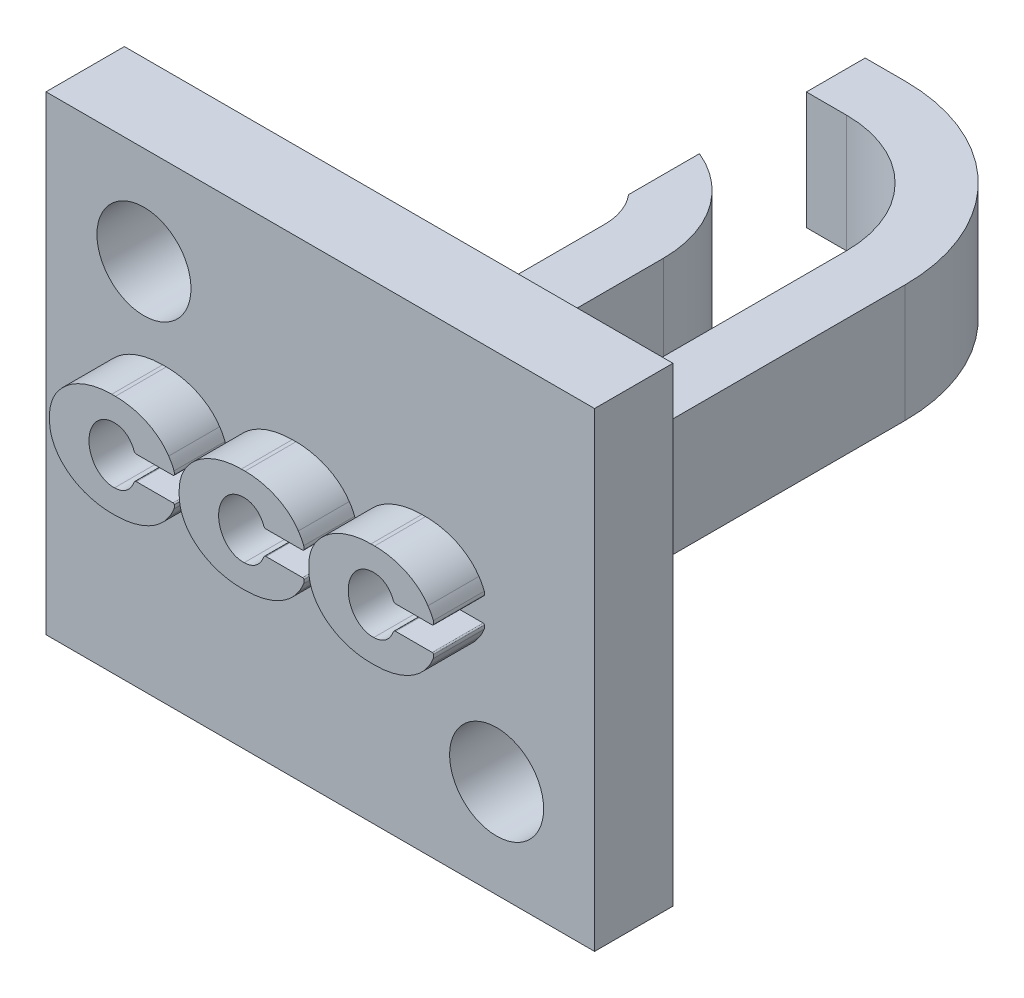
from build123d import *

# Parameters (mm, degrees)
SKETCH1_W           = 15
SKETCH1_H           = 12
BOSS_EXTRUDE1_DEPTH = 2
BOSS_EXTRUDE2_DEPTH = 2
SKETCH3_W           = 1.5
SKETCH3_H           = 3.5
BOSS_EXTRUDE3_DEPTH = 1.5
FILLET3_R           = 1.5
FILLET4_R           = 3
FILLET5_R           = 3
FILLET6_R           = 4.5
SKETCH4_W           = 2
SKETCH4_H           = 12
CUT_EXTRUDE1_DEPTH  = 1
SKETCH5_R           = 1.2
CUT_EXTRUDE2_DEPTH  = 17.731407672
CUT_EXTRUDE3_START  = -0.7
CUT_EXTRUDE3_DEPTH  = 0.7
SKETCH7_W           = 1.148621372
SKETCH7_H           = 6.2
CUT_EXTRUDE4_DEPTH  = 18.325992122
SKETCH8_W           = 0.2
SKETCH8_H           = 3.5
CUT_EXTRUDE5_DEPTH  = 18.325992122


with BuildPart() as part:
    # Sketch1 → Boss-Extrude1 (new body)
    with BuildSketch(Plane.XY):
        Rectangle(SKETCH1_W, SKETCH1_H)
    extrude(amount=BOSS_EXTRUDE1_DEPTH)

    # Sketch2 → Boss-Extrude2 (add)
    with BuildSketch(Plane.XY.offset(2)):
        with BuildLine():
            Line((-0.583484164, 0.443787032), (0.352350759, 0.443787032))
            ThreePointArc((0.352350759, 0.443787032), (0.370660979, 0.451874829), (0.381594807, 0.468641703))
            ThreePointArc((0.381594807, 0.468641703), (0.38478126, 0.512633483), (0.377406248, 0.556119567))
            ThreePointArc((0.377406248, 0.556119567), (0.316958398, 0.689104808), (0.240244136, 0.81341868))
            add(Edge.make_bspline(
                [(0.240244136, 0.81341868), (-0.178053426, 1.454553053), (-1.120854898, 1.454553053)],
                knots=[3.484341046, 3.484341046, 3.484341046, 4.522924348, 4.522924348, 4.522924348], degree=2, weights=[1, 0.868170926, 1]))
            Line((-1.120854898, 1.454553053), (-1.214475951, 1.454553068))
            add(Edge.make_bspline(
                [(-1.214475951, 1.454553068), (-2.800132813, 1.454553068), (-2.800132813, 0.203397992)],
                knots=[1.670440536, 1.670440536, 1.670440536, 3.203377674, 3.203377674, 3.203377674], degree=2, weights=[1, 0.720364542, 1]))
            Line((-2.800132813, 0.203397992), (-2.800132806, 0.073267738))
            add(Edge.make_bspline(
                [(-2.800132806, 0.073267738), (-2.800132806, -1.177887338), (-1.214475944, -1.177887338)],
                knots=[3.079807634, 3.079807634, 3.079807634, 4.612744771, 4.612744771, 4.612744771], degree=2, weights=[1, 0.720364542, 1]))
            Line((-1.214475944, -1.177887338), (-1.120854891, -1.177887375))
            add(Edge.make_bspline(
                [(-1.120854891, -1.177887375), (-0.178053419, -1.177887375), (0.240244143, -0.536753002)],
                knots=[1.760260959, 1.760260959, 1.760260959, 2.798844261, 2.798844261, 2.798844261], degree=2, weights=[1, 0.868170926, 1]))
            ThreePointArc((0.240244143, -0.536753002), (0.313994237, -0.417650167), (0.372658208, -0.290437354))
            ThreePointArc((0.372658208, -0.290437354), (0.384251196, -0.24211404), (0.382489087, -0.192450825))
            ThreePointArc((0.382489087, -0.192450825), (0.370484527, -0.171527836), (0.347824512, -0.163257123))
            Line((0.347824512, -0.163257123), (-0.58348421, -0.163257123))
            ThreePointArc((-0.58348421, -0.163257123), (-0.62125204, -0.175257922), (-0.645165579, -0.206858093))
            add(Edge.make_bspline(
                [(-1.141657158, -0.577741646), (-0.776549247, -0.578100851), (-0.645165579, -0.206858093)],
                knots=[5.955155363, 5.955155363, 5.955155363, 7.020735545, 7.020735545, 7.020735545], degree=2, weights=[1, 0.86139323, 1]))
            add(Edge.make_bspline(
                [(-1.201450314, 0.854894524), (-1.823540048, 0.823436889), (-1.793554178, 0.104979402), (-1.763568309, -0.613478086), (-1.141657158, -0.577741646)],
                knots=[0.039432941, 0.039432941, 0.039432941, 1.613207044, 1.613207044, 3.186981147, 3.186981147, 3.186981147], degree=2, weights=[1, 0.706053195, 1, 0.706053195, 1]))
            add(Edge.make_bspline(
                [(-0.645165584, 0.487388037), (-0.79140441, 0.900606071), (-1.201450314, 0.854894524)],
                knots=[2.404042441, 2.404042441, 2.404042441, 3.565685694, 3.565685694, 3.565685694], degree=2, weights=[1, 0.836012096, 1]))
            ThreePointArc((-0.645165584, 0.487388037), (-0.621252025, 0.455787841), (-0.583484164, 0.443787032))
        make_face()
        with BuildLine():
            Line((-3.89178871, 0.443787032), (-2.955953786, 0.443787032))
            ThreePointArc((-2.955953786, 0.443787032), (-2.937643536, 0.451874816), (-2.926709688, 0.468641703))
            ThreePointArc((-2.926709688, 0.468641703), (-2.923523234, 0.512633483), (-2.930898247, 0.556119567))
            ThreePointArc((-2.930898247, 0.556119567), (-2.991346096, 0.689104808), (-3.068060358, 0.81341868))
            add(Edge.make_bspline(
                [(-3.068060358, 0.81341868), (-3.48635792, 1.454553053), (-4.429159392, 1.454553053)],
                knots=[3.484341046, 3.484341046, 3.484341046, 4.522924348, 4.522924348, 4.522924348], degree=2, weights=[1, 0.868170926, 1]))
            Line((-4.429159392, 1.454553053), (-4.522780446, 1.454553068))
            add(Edge.make_bspline(
                [(-4.522780446, 1.454553068), (-6.108437307, 1.454553068), (-6.108437307, 0.203397992)],
                knots=[4.81203319, 4.81203319, 4.81203319, 6.344970327, 6.344970327, 6.344970327], degree=2, weights=[1, 0.720364542, 1]))
            Line((-6.108437307, 0.203397992), (-6.108437352, 0.073267738))
            add(Edge.make_bspline(
                [(-6.108437352, 0.073267738), (-6.108437352, -1.177887338), (-4.52278049, -1.177887338)],
                knots=[6.221400287, 6.221400287, 6.221400287, 7.754337425, 7.754337425, 7.754337425], degree=2, weights=[1, 0.720364542, 1]))
            Line((-4.52278049, -1.177887338), (-4.429159437, -1.177887375))
            add(Edge.make_bspline(
                [(-4.429159437, -1.177887375), (-3.486357965, -1.177887375), (-3.068060402, -0.536753002)],
                knots=[1.760260959, 1.760260959, 1.760260959, 2.798844261, 2.798844261, 2.798844261], degree=2, weights=[1, 0.868170926, 1]))
            ThreePointArc((-3.068060402, -0.536753002), (-2.994310308, -0.417650167), (-2.935646337, -0.290437354))
            ThreePointArc((-2.935646337, -0.290437354), (-2.92405335, -0.24211404), (-2.925815458, -0.192450825))
            ThreePointArc((-2.925815458, -0.192450825), (-2.937820019, -0.171527836), (-2.960480033, -0.163257123))
            Line((-2.960480033, -0.163257123), (-3.891788755, -0.163257123))
            ThreePointArc((-3.891788755, -0.163257123), (-3.929556585, -0.175257922), (-3.953470124, -0.206858093))
            add(Edge.make_bspline(
                [(-4.449961703, -0.577741646), (-4.084853792, -0.578100851), (-3.953470124, -0.206858093)],
                knots=[5.955155363, 5.955155363, 5.955155363, 7.020735545, 7.020735545, 7.020735545], degree=2, weights=[1, 0.86139323, 1]))
            add(Edge.make_bspline(
                [(-4.509754859, 0.854894524), (-5.131844593, 0.82343689), (-5.101858724, 0.104979402), (-5.071872854, -0.613478086), (-4.449961703, -0.577741646)],
                knots=[0.039432941, 0.039432941, 0.039432941, 1.613207044, 1.613207044, 3.186981147, 3.186981147, 3.186981147], degree=2, weights=[1, 0.706053195, 1, 0.706053195, 1]))
            add(Edge.make_bspline(
                [(-3.95347013, 0.487388037), (-4.099708956, 0.900606071), (-4.509754859, 0.854894524)],
                knots=[2.40404244, 2.40404244, 2.40404244, 3.565685694, 3.565685694, 3.565685694], degree=2, weights=[1, 0.836012096, 1]))
            ThreePointArc((-3.95347013, 0.487388037), (-3.92955657, 0.455787841), (-3.89178871, 0.443787032))
        make_face()
        with BuildLine():
            Line((2.724820382, 0.443787032), (3.660655305, 0.443787032))
            ThreePointArc((3.660655305, 0.443787032), (3.678965525, 0.451874829), (3.689899353, 0.468641703))
            ThreePointArc((3.689899353, 0.468641703), (3.693085806, 0.512633483), (3.685710794, 0.556119567))
            ThreePointArc((3.685710794, 0.556119567), (3.625262944, 0.689104808), (3.548548682, 0.81341868))
            add(Edge.make_bspline(
                [(3.548548682, 0.81341868), (3.13025112, 1.454553053), (2.187449648, 1.454553053)],
                knots=[0.342748392, 0.342748392, 0.342748392, 1.381331695, 1.381331695, 1.381331695], degree=2, weights=[1, 0.868170926, 1]))
            Line((2.187449648, 1.454553053), (2.093828595, 1.454553068))
            add(Edge.make_bspline(
                [(2.093828595, 1.454553068), (0.508171733, 1.454553068), (0.508171733, 0.203397992)],
                knots=[4.81203319, 4.81203319, 4.81203319, 6.344970327, 6.344970327, 6.344970327], degree=2, weights=[1, 0.720364542, 1]))
            Line((0.508171733, 0.203397992), (0.50817174, 0.073267738))
            add(Edge.make_bspline(
                [(0.50817174, 0.073267738), (0.50817174, -1.177887338), (2.093828602, -1.177887338)],
                knots=[3.079807634, 3.079807634, 3.079807634, 4.612744771, 4.612744771, 4.612744771], degree=2, weights=[1, 0.720364542, 1]))
            Line((2.093828602, -1.177887338), (2.187449655, -1.177887375))
            add(Edge.make_bspline(
                [(2.187449655, -1.177887375), (3.130251127, -1.177887375), (3.548548689, -0.536753002)],
                knots=[1.760260959, 1.760260959, 1.760260959, 2.798844261, 2.798844261, 2.798844261], degree=2, weights=[1, 0.868170926, 1]))
            ThreePointArc((3.548548689, -0.536753002), (3.622298783, -0.417650167), (3.680962754, -0.290437354))
            ThreePointArc((3.680962754, -0.290437354), (3.692555742, -0.24211404), (3.690793633, -0.192450825))
            ThreePointArc((3.690793633, -0.192450825), (3.678789073, -0.171527836), (3.656129058, -0.163257123))
            Line((3.656129058, -0.163257123), (2.724820336, -0.163257123))
            ThreePointArc((2.724820336, -0.163257123), (2.687052506, -0.175257922), (2.663138967, -0.206858093))
            add(Edge.make_bspline(
                [(2.166647388, -0.577741646), (2.531755299, -0.578100851), (2.663138967, -0.206858093)],
                knots=[5.955155363, 5.955155363, 5.955155363, 7.020735545, 7.020735545, 7.020735545], degree=2, weights=[1, 0.86139323, 1]))
            add(Edge.make_bspline(
                [(2.106854232, 0.854894524), (1.484764498, 0.823436889), (1.514750368, 0.104979402), (1.544736237, -0.613478086), (2.166647388, -0.577741646)],
                knots=[3.181025595, 3.181025595, 3.181025595, 4.754799698, 4.754799698, 6.328573801, 6.328573801, 6.328573801], degree=2, weights=[1, 0.706053195, 1, 0.706053195, 1]))
            add(Edge.make_bspline(
                [(2.663138962, 0.487388037), (2.516900136, 0.900606071), (2.106854232, 0.854894524)],
                knots=[5.545635094, 5.545635094, 5.545635094, 6.707278348, 6.707278348, 6.707278348], degree=2, weights=[1, 0.836012096, 1]))
            ThreePointArc((2.663138962, 0.487388037), (2.687052521, 0.455787841), (2.724820382, 0.443787032))
        make_face()
    extrude(amount=BOSS_EXTRUDE2_DEPTH)

    # Sketch3 → Boss-Extrude3 (add, symmetric)
    with BuildSketch(Plane(origin=(0, 0, 0), x_dir=(1, 0, 0), z_dir=(0, 1, 0))):
        Polygon((1.72873188, 0), (3.22873188, 0), (3.22873188, 13.7), (-3.442646753, 13.7), (-3.442646753, 12.2), (1.72873188, 12.2), align=None)
        with Locations((-3.644025381, 1.75)):
            Rectangle(SKETCH3_W, SKETCH3_H)
        Polygon((-1.942646753, 0), (-0.442646753, 0), (-0.442646753, 9.7), (-3.442646753, 9.7), (-3.442646753, 8.2), (-1.942646753, 8.2), align=None)
    extrude(amount=BOSS_EXTRUDE3_DEPTH, both=True)

    # Fillet3
    fillet3_edges = [part.edges().sort_by_distance(p)[0] for p in [
        (-1.942646753, 0, -8.2),
    ]]
    fillet(fillet3_edges, radius=FILLET3_R - 0.0001)  # a hair under: the kernel refuses the full size

    # Fillet4
    fillet4_edges = [part.edges().sort_by_distance(p)[0] for p in [
        (-0.442646753, 0, -9.7),
    ]]
    fillet(fillet4_edges, radius=FILLET4_R - 0.0001)  # a hair under: the kernel refuses the full size

    # Fillet5
    fillet5_edges = [part.edges().sort_by_distance(p)[0] for p in [
        (1.72873188, 0, -12.2),
    ]]
    fillet(fillet5_edges, radius=FILLET5_R)

    # Fillet6
    fillet6_edges = [part.edges().sort_by_distance(p)[0] for p in [
        (3.22873188, 0, -13.7),
    ]]
    fillet(fillet6_edges, radius=FILLET6_R)

    # Sketch4 → Cut-Extrude1 (cut)
    with BuildSketch(Plane(origin=(7.5, 0, 0), x_dir=(0, 0, -1), z_dir=(1, 0, 0))):
        with Locations((-1, 0)):
            Rectangle(SKETCH4_W, SKETCH4_H)
    extrude(amount=-CUT_EXTRUDE1_DEPTH, mode=Mode.SUBTRACT)

    # Sketch5 → Cut-Extrude2 (cut, through all)
    with BuildSketch(Plane(origin=(0, 0, 0), x_dir=(-1, 0, 0), z_dir=(0, 0, -1))):
        with Locations((-4, -3.5)):
            Circle(SKETCH5_R)
        with Locations((5, 3.5)):
            Circle(SKETCH5_R)
    extrude(amount=-CUT_EXTRUDE2_DEPTH, mode=Mode.SUBTRACT)

    # Sketch6 → Cut-Extrude3 (cut)
    with BuildSketch(Plane.XY.offset(4).offset(CUT_EXTRUDE3_START)):
        with BuildLine():
            Line((2.724820382, 0.443787032), (3.660655305, 0.443787032))
            ThreePointArc((3.660655305, 0.443787032), (3.678965525, 0.451874829), (3.689899353, 0.468641703))
            ThreePointArc((3.689899353, 0.468641703), (3.693085806, 0.512633483), (3.685710794, 0.556119567))
            ThreePointArc((3.685710794, 0.556119567), (3.625262944, 0.689104808), (3.548548682, 0.81341868))
            add(Edge.make_bspline(
                [(3.548548682, 0.81341868), (3.13025112, 1.454553053), (2.187449648, 1.454553053)],
                knots=[0.342748392, 0.342748392, 0.342748392, 1.381331695, 1.381331695, 1.381331695], degree=2, weights=[1, 0.868170926, 1]))
            Line((2.187449648, 1.454553053), (2.093828595, 1.454553068))
            add(Edge.make_bspline(
                [(2.093828595, 1.454553068), (0.508171733, 1.454553068), (0.508171733, 0.203397992)],
                knots=[4.81203319, 4.81203319, 4.81203319, 6.344970327, 6.344970327, 6.344970327], degree=2, weights=[1, 0.720364542, 1]))
            Line((0.508171733, 0.203397992), (0.50817174, 0.073267738))
            add(Edge.make_bspline(
                [(0.50817174, 0.073267738), (0.50817174, -1.177887338), (2.093828602, -1.177887338)],
                knots=[3.079807634, 3.079807634, 3.079807634, 4.612744771, 4.612744771, 4.612744771], degree=2, weights=[1, 0.720364542, 1]))
            Line((2.093828602, -1.177887338), (2.187449655, -1.177887375))
            add(Edge.make_bspline(
                [(2.187449655, -1.177887375), (3.130251127, -1.177887375), (3.548548689, -0.536753002)],
                knots=[1.760260959, 1.760260959, 1.760260959, 2.798844261, 2.798844261, 2.798844261], degree=2, weights=[1, 0.868170926, 1]))
            ThreePointArc((3.548548689, -0.536753002), (3.622298783, -0.417650167), (3.680962754, -0.290437354))
            ThreePointArc((3.680962754, -0.290437354), (3.692555742, -0.24211404), (3.690793633, -0.192450825))
            ThreePointArc((3.690793633, -0.192450825), (3.678789073, -0.171527836), (3.656129058, -0.163257123))
            Line((3.656129058, -0.163257123), (2.724820336, -0.163257123))
            ThreePointArc((2.724820336, -0.163257123), (2.687052506, -0.175257922), (2.663138967, -0.206858093))
            add(Edge.make_bspline(
                [(2.166647388, -0.577741646), (2.531755299, -0.578100851), (2.663138967, -0.206858093)],
                knots=[5.955155363, 5.955155363, 5.955155363, 7.020735545, 7.020735545, 7.020735545], degree=2, weights=[1, 0.86139323, 1]))
            add(Edge.make_bspline(
                [(2.106854232, 0.854894524), (1.484764498, 0.823436889), (1.514750368, 0.104979402), (1.544736237, -0.613478086), (2.166647388, -0.577741646)],
                knots=[3.181025595, 3.181025595, 3.181025595, 4.754799698, 4.754799698, 6.328573801, 6.328573801, 6.328573801], degree=2, weights=[1, 0.706053195, 1, 0.706053195, 1]))
            add(Edge.make_bspline(
                [(2.663138962, 0.487388037), (2.516900136, 0.900606071), (2.106854232, 0.854894524)],
                knots=[2.404042441, 2.404042441, 2.404042441, 3.565685694, 3.565685694, 3.565685694], degree=2, weights=[1, 0.836012096, 1]))
            ThreePointArc((2.663138962, 0.487388037), (2.687052521, 0.455787841), (2.724820382, 0.443787032))
        make_face()
        with BuildLine():
            Line((-0.583484164, 0.443787032), (0.352350759, 0.443787032))
            ThreePointArc((0.352350759, 0.443787032), (0.370660979, 0.451874829), (0.381594807, 0.468641703))
            ThreePointArc((0.381594807, 0.468641703), (0.38478126, 0.512633483), (0.377406248, 0.556119567))
            ThreePointArc((0.377406248, 0.556119567), (0.316958398, 0.689104808), (0.240244136, 0.81341868))
            add(Edge.make_bspline(
                [(0.240244136, 0.81341868), (-0.178053426, 1.454553053), (-1.120854898, 1.454553053)],
                knots=[0.342748392, 0.342748392, 0.342748392, 1.381331695, 1.381331695, 1.381331695], degree=2, weights=[1, 0.868170926, 1]))
            Line((-1.120854898, 1.454553053), (-1.214475951, 1.454553068))
            add(Edge.make_bspline(
                [(-1.214475951, 1.454553068), (-2.800132813, 1.454553068), (-2.800132813, 0.203397992)],
                knots=[4.81203319, 4.81203319, 4.81203319, 6.344970327, 6.344970327, 6.344970327], degree=2, weights=[1, 0.720364542, 1]))
            Line((-2.800132813, 0.203397992), (-2.800132806, 0.073267738))
            add(Edge.make_bspline(
                [(-2.800132806, 0.073267738), (-2.800132806, -1.177887338), (-1.214475944, -1.177887338)],
                knots=[3.079807634, 3.079807634, 3.079807634, 4.612744771, 4.612744771, 4.612744771], degree=2, weights=[1, 0.720364542, 1]))
            Line((-1.214475944, -1.177887338), (-1.120854891, -1.177887375))
            add(Edge.make_bspline(
                [(-1.120854891, -1.177887375), (-0.178053419, -1.177887375), (0.240244143, -0.536753002)],
                knots=[1.760260959, 1.760260959, 1.760260959, 2.798844261, 2.798844261, 2.798844261], degree=2, weights=[1, 0.868170926, 1]))
            ThreePointArc((0.240244143, -0.536753002), (0.313994237, -0.417650167), (0.372658208, -0.290437354))
            ThreePointArc((0.372658208, -0.290437354), (0.384251196, -0.24211404), (0.382489087, -0.192450825))
            ThreePointArc((0.382489087, -0.192450825), (0.370484527, -0.171527836), (0.347824512, -0.163257123))
            Line((0.347824512, -0.163257123), (-0.58348421, -0.163257123))
            ThreePointArc((-0.58348421, -0.163257123), (-0.62125204, -0.175257922), (-0.645165579, -0.206858093))
            add(Edge.make_bspline(
                [(-1.141657158, -0.577741646), (-0.776549247, -0.578100851), (-0.645165579, -0.206858093)],
                knots=[5.955155363, 5.955155363, 5.955155363, 7.020735545, 7.020735545, 7.020735545], degree=2, weights=[1, 0.86139323, 1]))
            add(Edge.make_bspline(
                [(-1.201450314, 0.854894524), (-1.823540048, 0.823436889), (-1.793554178, 0.104979402), (-1.763568309, -0.613478086), (-1.141657158, -0.577741646)],
                knots=[3.181025595, 3.181025595, 3.181025595, 4.754799698, 4.754799698, 6.328573801, 6.328573801, 6.328573801], degree=2, weights=[1, 0.706053195, 1, 0.706053195, 1]))
            add(Edge.make_bspline(
                [(-0.645165584, 0.487388037), (-0.79140441, 0.900606071), (-1.201450314, 0.854894524)],
                knots=[2.404042441, 2.404042441, 2.404042441, 3.565685694, 3.565685694, 3.565685694], degree=2, weights=[1, 0.836012096, 1]))
            ThreePointArc((-0.645165584, 0.487388037), (-0.621252025, 0.455787841), (-0.583484164, 0.443787032))
        make_face()
        with BuildLine():
            Line((-3.89178871, 0.443787032), (-2.955953786, 0.443787032))
            ThreePointArc((-2.955953786, 0.443787032), (-2.937643536, 0.451874816), (-2.926709688, 0.468641703))
            ThreePointArc((-2.926709688, 0.468641703), (-2.923523234, 0.512633483), (-2.930898247, 0.556119567))
            ThreePointArc((-2.930898247, 0.556119567), (-2.991346096, 0.689104808), (-3.068060358, 0.81341868))
            add(Edge.make_bspline(
                [(-3.068060358, 0.81341868), (-3.48635792, 1.454553053), (-4.429159392, 1.454553053)],
                knots=[0.342748392, 0.342748392, 0.342748392, 1.381331695, 1.381331695, 1.381331695], degree=2, weights=[1, 0.868170926, 1]))
            Line((-4.429159392, 1.454553053), (-4.522780446, 1.454553068))
            add(Edge.make_bspline(
                [(-4.522780446, 1.454553068), (-6.108437307, 1.454553068), (-6.108437307, 0.203397992)],
                knots=[4.81203319, 4.81203319, 4.81203319, 6.344970327, 6.344970327, 6.344970327], degree=2, weights=[1, 0.720364542, 1]))
            Line((-6.108437307, 0.203397992), (-6.108437352, 0.073267738))
            add(Edge.make_bspline(
                [(-6.108437352, 0.073267738), (-6.108437352, -1.177887338), (-4.52278049, -1.177887338)],
                knots=[3.079807634, 3.079807634, 3.079807634, 4.612744771, 4.612744771, 4.612744771], degree=2, weights=[1, 0.720364542, 1]))
            Line((-4.52278049, -1.177887338), (-4.429159437, -1.177887375))
            add(Edge.make_bspline(
                [(-4.429159437, -1.177887375), (-3.486357965, -1.177887375), (-3.068060402, -0.536753002)],
                knots=[1.760260959, 1.760260959, 1.760260959, 2.798844261, 2.798844261, 2.798844261], degree=2, weights=[1, 0.868170926, 1]))
            ThreePointArc((-3.068060402, -0.536753002), (-2.994310308, -0.417650167), (-2.935646337, -0.290437354))
            ThreePointArc((-2.935646337, -0.290437354), (-2.92405335, -0.24211404), (-2.925815458, -0.192450825))
            ThreePointArc((-2.925815458, -0.192450825), (-2.937820019, -0.171527836), (-2.960480033, -0.163257123))
            Line((-2.960480033, -0.163257123), (-3.891788755, -0.163257123))
            ThreePointArc((-3.891788755, -0.163257123), (-3.929556585, -0.175257922), (-3.953470124, -0.206858093))
            add(Edge.make_bspline(
                [(-4.449961703, -0.577741646), (-4.084853792, -0.578100851), (-3.953470124, -0.206858093)],
                knots=[5.955155363, 5.955155363, 5.955155363, 7.020735545, 7.020735545, 7.020735545], degree=2, weights=[1, 0.86139323, 1]))
            add(Edge.make_bspline(
                [(-4.509754859, 0.854894524), (-5.131844593, 0.82343689), (-5.101858724, 0.104979402), (-5.071872854, -0.613478086), (-4.449961703, -0.577741646)],
                knots=[3.181025595, 3.181025595, 3.181025595, 4.754799698, 4.754799698, 6.328573801, 6.328573801, 6.328573801], degree=2, weights=[1, 0.706053195, 1, 0.706053195, 1]))
            add(Edge.make_bspline(
                [(-3.95347013, 0.487388037), (-4.099708956, 0.900606071), (-4.509754859, 0.854894524)],
                knots=[2.40404244, 2.40404244, 2.40404244, 3.565685694, 3.565685694, 3.565685694], degree=2, weights=[1, 0.836012096, 1]))
            ThreePointArc((-3.95347013, 0.487388037), (-3.92955657, 0.455787841), (-3.89178871, 0.443787032))
        make_face()
    extrude(amount=CUT_EXTRUDE3_DEPTH, mode=Mode.SUBTRACT)

    # Sketch7 → Cut-Extrude4 (cut, through all)
    with BuildSketch(Plane(origin=(0, 1.5, 0), x_dir=(1, 0, 0), z_dir=(0, 1, 0))):
        with Locations((-2.868336067, 10.6)):
            Rectangle(SKETCH7_W, SKETCH7_H)
    extrude(amount=-CUT_EXTRUDE4_DEPTH, mode=Mode.SUBTRACT)

    # Sketch8 → Cut-Extrude5 (cut, through all)
    with BuildSketch(Plane(origin=(0, 1.5, 0), x_dir=(1, 0, 0), z_dir=(0, 1, 0))):
        with Locations((-4.294025381, 1.75)):
            Rectangle(SKETCH8_W, SKETCH8_H)
    extrude(amount=-CUT_EXTRUDE5_DEPTH, mode=Mode.SUBTRACT)


solid = part.part
